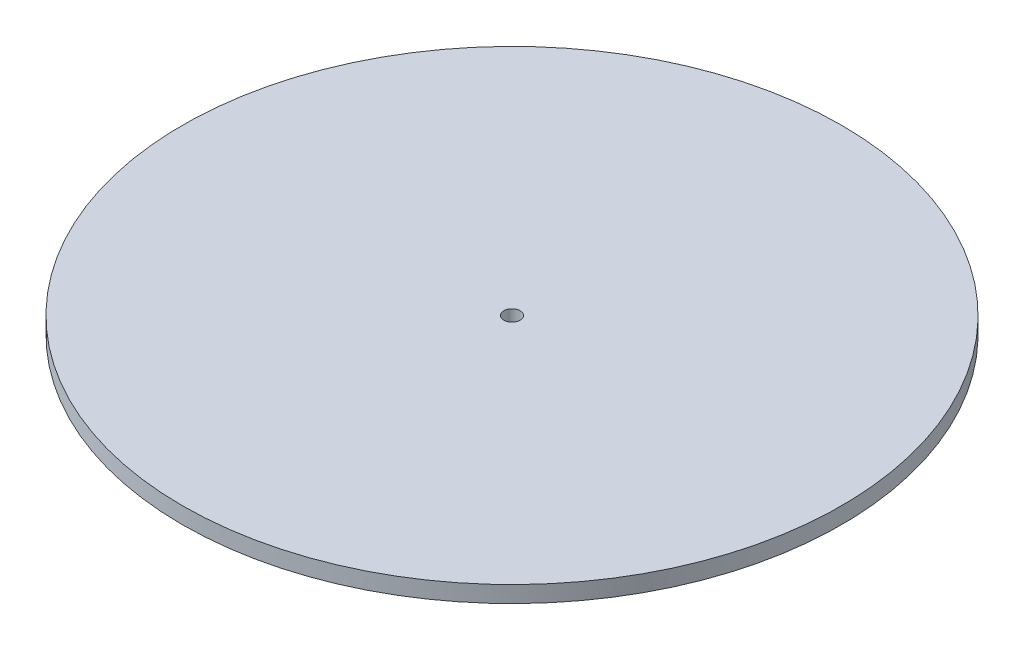
from build123d import *

# Parameters (mm, degrees)
SKETCH1_R           = 127
SKETCH1_R_2         = 3.175
BOSS_EXTRUDE1_DEPTH = 6.35


with BuildPart() as part:
    # Sketch1 → Boss-Extrude1 (new body)
    with BuildSketch(Plane(origin=(0, 0, 0), x_dir=(1, 0, 0), z_dir=(0, 1, 0))):
        Circle(SKETCH1_R)
        Circle(SKETCH1_R_2, mode=Mode.SUBTRACT)
    extrude(amount=BOSS_EXTRUDE1_DEPTH)


solid = part.part
